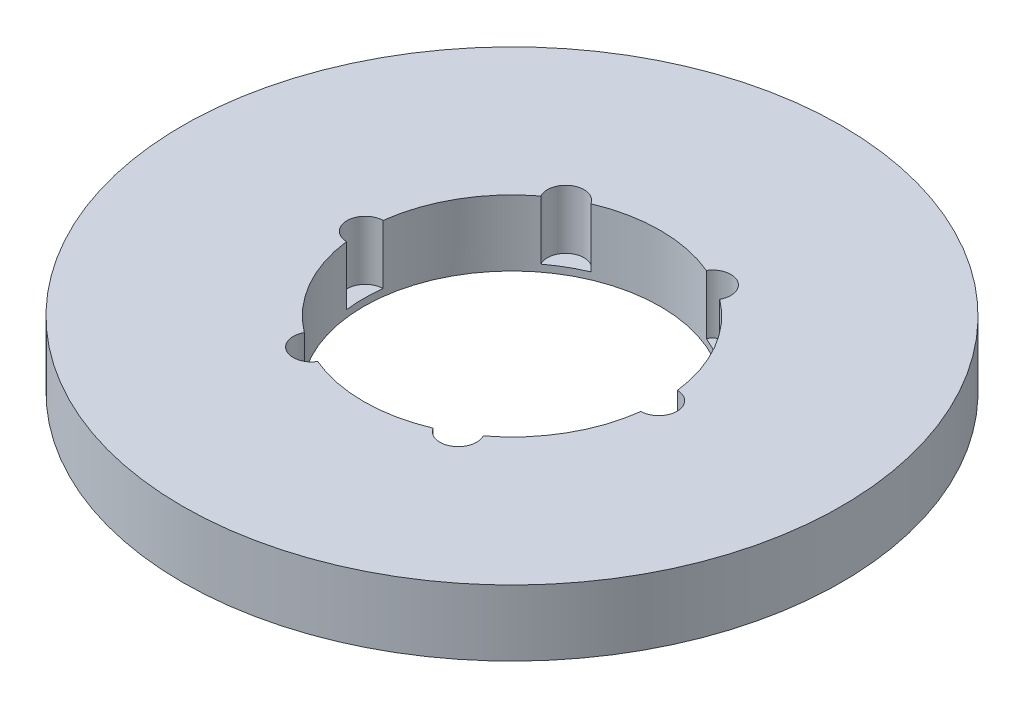
from build123d import *

# Parameters (mm, degrees)
SKETCH1_R           = 50
BOSS_EXTRUDE1_DEPTH = 10
SKETCH2_R           = 22.5
CUT_EXTRUDE1_DEPTH  = 72.414284285
SKETCH3_R           = 2.779698199
CUT_EXTRUDE2_DEPTH  = 8.950310544
CIRPATTERN1_COUNT   = 6


with BuildPart() as part:
    # Sketch1 → Boss-Extrude1 (new body)
    with BuildSketch(Plane(origin=(0, 0, 0), x_dir=(1, 0, 0), z_dir=(0, 1, 0))):
        Circle(SKETCH1_R)
    extrude(amount=BOSS_EXTRUDE1_DEPTH)

    # Sketch2 → Cut-Extrude1 (cut, through all)
    with BuildSketch(Plane(origin=(0, 0, 0), x_dir=(1, 0, 0), z_dir=(0, 1, 0))):
        Circle(SKETCH2_R)
    extrude(amount=CUT_EXTRUDE1_DEPTH, mode=Mode.SUBTRACT)

    # Sketch3 → Cut-Extrude2 (cut)
    with BuildSketch(Plane(origin=(0, 10, 0), x_dir=(1, 0, 0), z_dir=(0, 1, 0))):
        with Locations((-22.267901177, 0)):
            Circle(SKETCH3_R)
    cut_extrude2 = extrude(amount=-CUT_EXTRUDE2_DEPTH, mode=Mode.SUBTRACT)

    # CirPattern1: Cut-Extrude2 ×6 about axis
    cirpattern1_axis = Axis((0, 0, 0), (0, 1, 0))
    for i in range(1, CIRPATTERN1_COUNT):
        add(cut_extrude2.rotate(cirpattern1_axis, i * 360 / CIRPATTERN1_COUNT), mode=Mode.SUBTRACT)


solid = part.part
